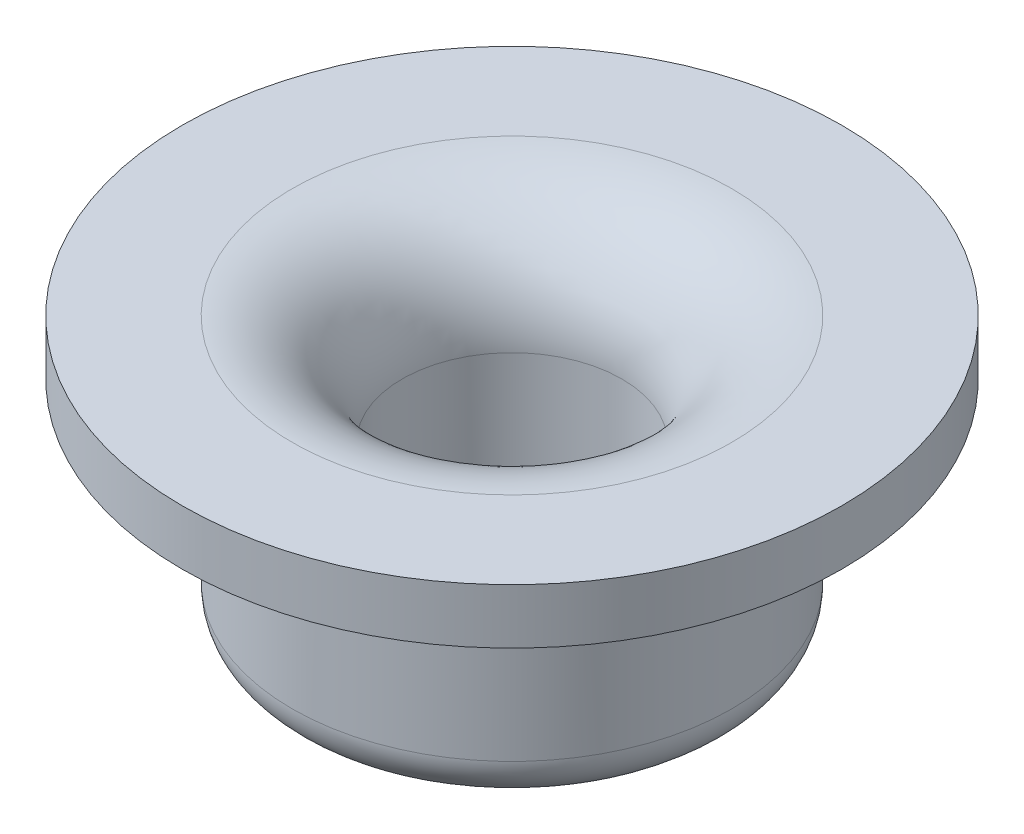
from build123d import *

# Parameters (mm, degrees)
FILLET1_R = 3.175
FILLET4_R = 1.27


with BuildPart() as part:
    # Sketch1 → Revolve1 (revolve)
    with BuildSketch(Plane(origin=(0, 0, 0), x_dir=(0, 0, -1), z_dir=(1, 0, 0))):
        Polygon((-3.175, 0), (-3.175, 7.9375), (-9.525, 7.9375), (-9.525, 6.35), (-6.35, 6.35), (-6.35, 0), align=None)
    revolve(axis=Axis((0, 0, 0), (0, 1, 0)))

    # Fillet1
    fillet1_edges = [part.edges().sort_by_distance(p)[0] for p in [
        (0, 7.9375, -3.175),
    ]]
    fillet(fillet1_edges, radius=FILLET1_R)

    # Fillet4
    fillet4_edges = [part.edges().sort_by_distance(p)[0] for p in [
        (0, 0, -6.35),
        (0, 0, -3.175),
    ]]
    fillet(fillet4_edges, radius=FILLET4_R)


solid = part.part
